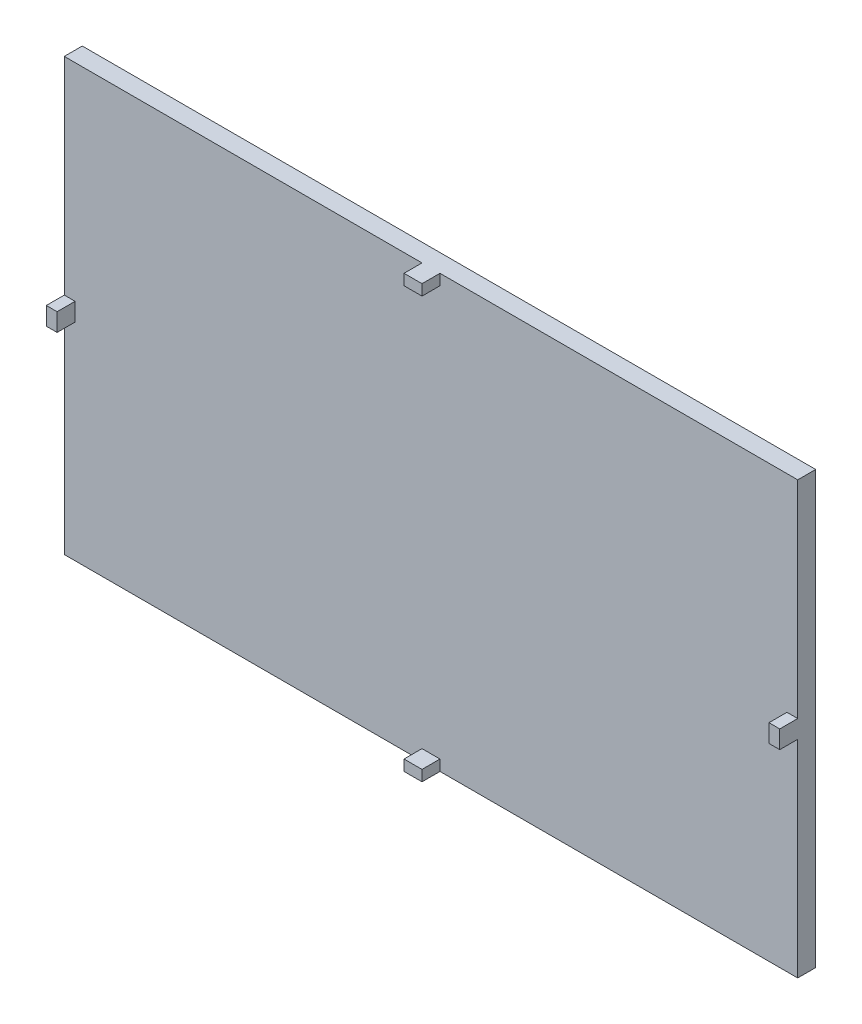
from build123d import *

# Parameters (mm, degrees)
ESBO_O1_W                = 204
ESBO_O1_H                = 120
RESSALTO_EXTRUS_O1_DEPTH = 5
ESBO_O2_W                = 5
ESBO_O2_H                = 3
ESBO_O2_W_2              = 3
ESBO_O2_H_2              = 5
RESSALTO_EXTRUS_O2_DEPTH = 5


with BuildPart() as part:
    # Esboço1 → Ressalto-extrusão1 (new body)
    with BuildSketch(Plane.XY):
        with Locations((50.579294312, -29.131049069)):
            Rectangle(ESBO_O1_W, ESBO_O1_H)
    extrude(amount=RESSALTO_EXTRUS_O1_DEPTH)

    # Esboço2 → Ressalto-extrusão2 (add)
    with BuildSketch(Plane.XY.offset(5)):
        with Locations((50.579294312, 29.368950931)):
            Rectangle(ESBO_O2_W, ESBO_O2_H)
        with Locations((50.579294312, -87.631049069)):
            Rectangle(ESBO_O2_W, ESBO_O2_H)
        with Locations((-49.920705688, -29.131049069)):
            Rectangle(ESBO_O2_W_2, ESBO_O2_H_2)
        with Locations((151.079294312, -29.131049069)):
            Rectangle(ESBO_O2_W_2, ESBO_O2_H_2)
    extrude(amount=RESSALTO_EXTRUS_O2_DEPTH)


solid = part.part
